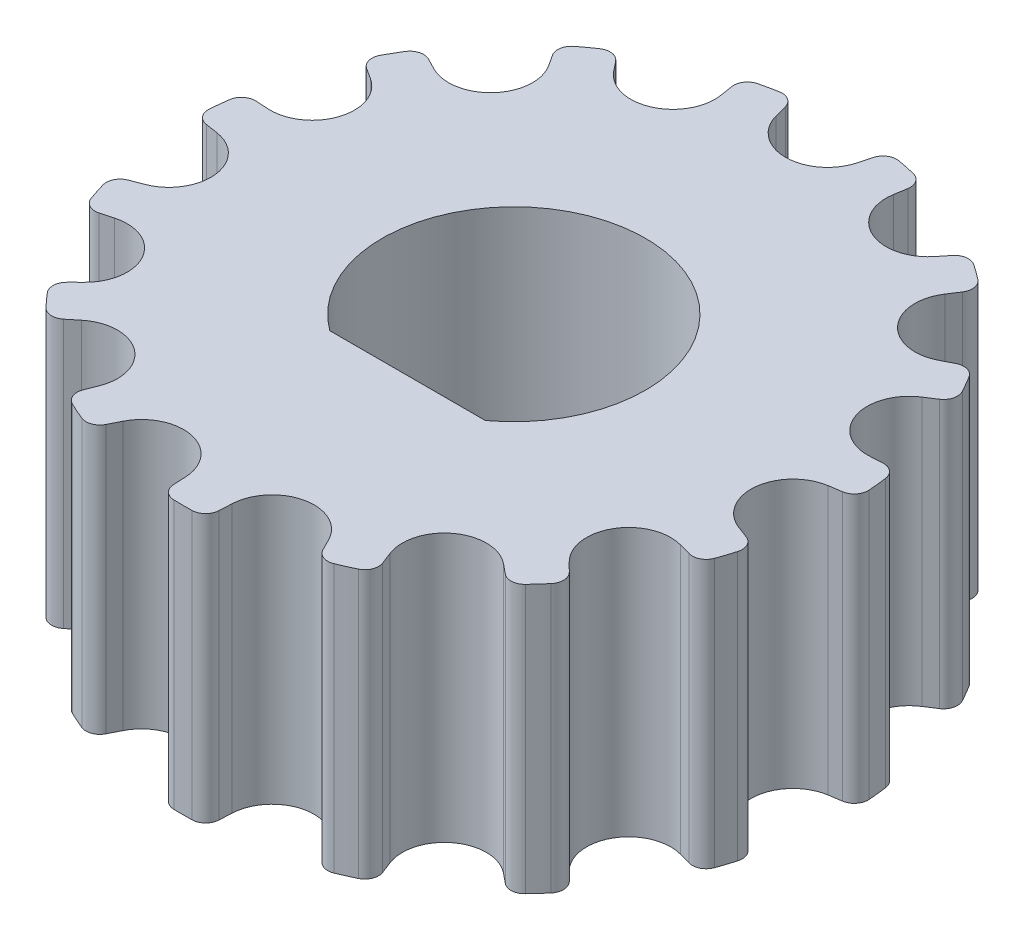
from build123d import *

# Parameters (mm, degrees)
SKETCH1_R           = 7.161972439
BOSS_EXTRUDE1_DEPTH = 5.8
CUT_EXTRUDE1_DEPTH  = 12.671662197
CIRPATTERN1_COUNT   = 15
CUT_EXTRUDE2_DEPTH  = 12.659198501


with BuildPart() as part:
    # Sketch1 → Boss-Extrude1 (new body)
    with BuildSketch(Plane(origin=(0, 0, 0), x_dir=(1, 0, 0), z_dir=(0, 1, 0))):
        Circle(SKETCH1_R)
    extrude(amount=BOSS_EXTRUDE1_DEPTH)

    # Sketch2 → Cut-Extrude1 (cut, through all)
    with BuildSketch(Plane(origin=(0, 5.8, 0), x_dir=(1, 0, 0), z_dir=(0, 1, 0))):
        with BuildLine():
            Line((-0.879885324, 6.559804793), (-0.95, 6.825530337))
            ThreePointArc((-0.95, 6.825530337), (-1.079308013, 7.002279754), (-1.294287054, 7.044052118))
            ThreePointArc((-1.294287054, 7.044052118), (-2.118539526, 6.841464719), (-2.913036628, 6.54278739))
            Line((-2.913036628, 6.54278739), (-2.913036628, 7.161972439))
            Line((-2.913036628, 7.161972439), (2.913036628, 7.161972439))
            Line((2.913036628, 7.161972439), (2.913036628, 6.54278739))
            ThreePointArc((2.913036628, 6.54278739), (2.118539526, 6.841464719), (1.294287054, 7.044052118))
            ThreePointArc((1.294287054, 7.044052118), (1.079308013, 7.002279754), (0.95, 6.825530337))
            Line((0.95, 6.825530337), (0.879885324, 6.559804793))
            ThreePointArc((0.879885324, 6.559804793), (0, 5.881972439), (-0.879885324, 6.559804793))
        make_face()
    cut_extrude1 = extrude(amount=-CUT_EXTRUDE1_DEPTH, mode=Mode.SUBTRACT)

    # CirPattern1: Cut-Extrude1 ×15 about axis
    cirpattern1_axis = Axis((0, 5.8, 0), (0, -1, 0))
    for i in range(1, CIRPATTERN1_COUNT):
        add(cut_extrude1.rotate(cirpattern1_axis, i * 360 / CIRPATTERN1_COUNT), mode=Mode.SUBTRACT)

    # Sketch3 → Cut-Extrude2 (cut, through all)
    with BuildSketch(Plane.XZ):
        with BuildLine():
            Line((1.683003268, 2.3), (-1.683003268, 2.3))
            ThreePointArc((-1.683003268, 2.3), (0, -2.85), (1.683003268, 2.3))
        make_face()
    extrude(amount=-CUT_EXTRUDE2_DEPTH, mode=Mode.SUBTRACT)


solid = part.part
